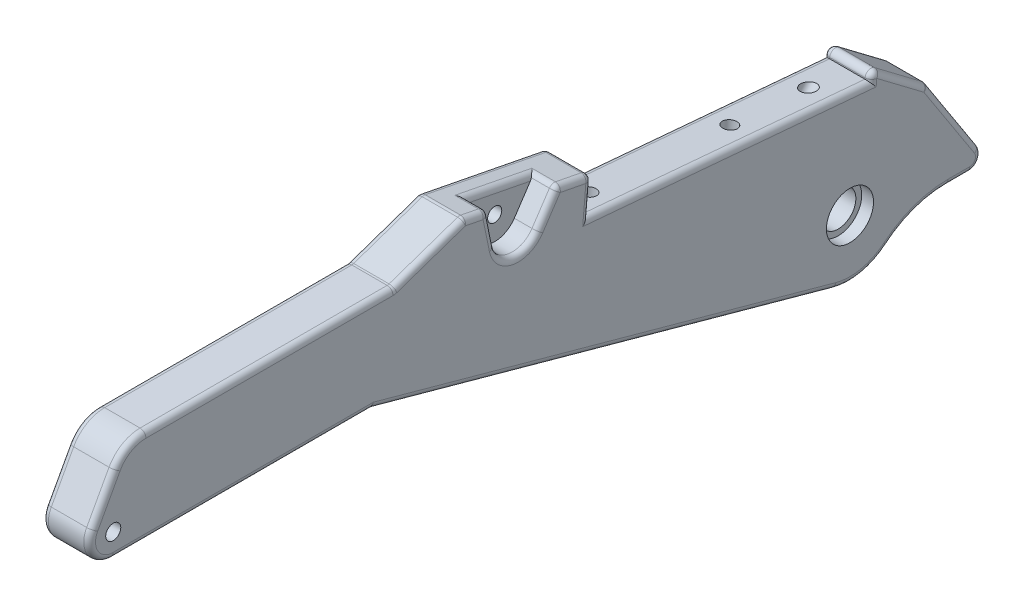
from build123d import *

# Parameters (mm, degrees)
SKETCH1_R           = 2.032
BOSS_EXTRUDE1_DEPTH = 12.7
FILLET1_R           = 9.525
SKETCH2_R           = 4.7625
CUT_EXTRUDE1_DEPTH  = 238.90790865
SKETCH4_R           = 6.35
CUT_EXTRUDE2_DEPTH  = 3.175
CUT_EXTRUDE6_DEPTH  = 6.35
SKETCH10_R          = 1.905
CUT_EXTRUDE7_DEPTH  = 238.653540891
FILLET2_R           = 1.5875
SKETCH6_R           = 1.905
CUT_EXTRUDE3_DEPTH  = 25.4
SKETCH7_R           = 1.905
CUT_EXTRUDE4_DEPTH  = 15.875
SKETCH8_R           = 1.905
CUT_EXTRUDE5_DEPTH  = 12.7


with BuildPart() as part:
    # Sketch1 → Boss-Extrude1 (new body)
    with BuildSketch(Plane(origin=(0, 0, 0), x_dir=(0, 0, -1), z_dir=(1, 0, 0))):
        with BuildLine():
            Line((-5.574599012, 3.040780467), (3.157961292, 19.05))
            Line((3.157961292, 19.05), (75.662744852, 19.05))
            Line((75.662744852, 19.05), (94.776183001, 25.614386431))
            Line((94.776183001, 25.614386431), (129.054233098, 18.923279907))
            Line((129.054233098, 18.923279907), (128.224074649, 9.434525408))
            Line((128.224074649, 9.434525408), (204.134110643, 2.79325781))
            Line((204.134110643, 2.79325781), (204.161005679, 3.100669472))
            ThreePointArc((204.161005679, 3.100669472), (205.09730431, 4.412800765), (206.698779384, 4.229439793))
            Line((206.698779384, 4.229439793), (219.392961654, -5.350975413))
            ThreePointArc((219.392961654, -5.350975413), (219.598467913, -5.536288257), (219.768672831, -5.75447157))
            Line((219.768672831, -5.75447157), (233.444725546, -26.84773219))
            ThreePointArc((233.444725546, -26.84773219), (233.570360338, -30.091006218), (230.780673949, -31.75))
            Line((230.780673949, -31.75), (224.896696771, -31.75))
            ThreePointArc((224.896696771, -31.75), (216.268745771, -33.260285445), (208.666831685, -37.611538462))
            ThreePointArc((208.666831685, -37.611538462), (201.862183679, -40.919877125), (194.299038193, -40.702691568))
            Line((194.299038193, -40.702691568), (69.85, -6.35))
            Line((69.85, -6.35), (0, -6.35))
            ThreePointArc((0, -6.35), (-5.460378007, -3.241415126), (-5.574599012, 3.040780467))
        make_face()
        Circle(SKETCH1_R, mode=Mode.SUBTRACT)
    extrude(amount=BOSS_EXTRUDE1_DEPTH)

    # Fillet1
    fillet1_edges = [part.edges().sort_by_distance(p)[0] for p in [
        (6.35, 19.05, -3.157961292),
    ]]
    fillet(fillet1_edges, radius=FILLET1_R)

    # Sketch2 → Cut-Extrude1 (cut, through all)
    with BuildSketch(Plane.ZY):
        with Locations((-198.523166007, -25.4)):
            Circle(SKETCH2_R)
    extrude(amount=-CUT_EXTRUDE1_DEPTH, mode=Mode.SUBTRACT)

    # Sketch4 → Cut-Extrude2 (cut)
    with BuildSketch(Plane(origin=(12.7, 0, 0), x_dir=(0, 0, -1), z_dir=(1, 0, 0))):
        with Locations((198.523166007, -25.4)):
            Circle(SKETCH4_R)
    extrude(amount=-CUT_EXTRUDE2_DEPTH, mode=Mode.SUBTRACT)

    # Sketch9 → Cut-Extrude6 (cut)
    with BuildSketch(Plane(origin=(12.7, 0, 0), x_dir=(0, 0, -1), z_dir=(1, 0, 0))):
        with BuildLine():
            Line((102.919681037, 15.066518102), (101.008555746, 24.397821608))
            Line((101.008555746, 24.397821608), (119.705673981, 20.748127141))
            Line((119.705673981, 20.748127141), (114.425599951, 12.820552276))
            ThreePointArc((114.425599951, 12.820552276), (107.923985218, 10.108228884), (102.919681037, 15.066518102))
        make_face()
    extrude(amount=-CUT_EXTRUDE6_DEPTH, mode=Mode.SUBTRACT)

    # Sketch10 → Cut-Extrude7 (cut, through all)
    with BuildSketch(Plane(origin=(6.35, 0, 0), x_dir=(0, 0, -1), z_dir=(1, 0, 0))):
        with Locations((109.140550041, 16.340601629)):
            Circle(SKETCH10_R)
    extrude(amount=-CUT_EXTRUDE7_DEPTH, mode=Mode.SUBTRACT)

    # Fillet2
    fillet2_edges = [part.edges().sort_by_distance(p)[0] for p in [
        (0, 2.946963641, -204.147558161),
        (0, 4.412800765, -205.09730431),
        (0, -0.56076781, -213.045870519),
        (0, -5.536288257, -219.598467913),
        (0, -16.30110188, -226.606699189),
        (0, -30.091006218, -233.570360338),
        (0, -31.75, -227.83868536),
        (0, -33.260285445, -216.268745771),
        (0, -40.919877125, -201.862183679),
        (0, -6.35, -34.925),
        (0, -3.241415126, 5.460378007),
        (0, 8.563475584, 2.5621306),
        (0, 17.715567011, -3.950113643),
        (12.7, 2.946963641, -204.147558161),
        (12.7, 4.412800765, -205.09730431),
        (12.7, -0.56076781, -213.045870519),
        (12.7, -5.536288257, -219.598467913),
        (12.7, -16.30110188, -226.606699189),
        (12.7, -30.091006218, -233.570360338),
        (12.7, -31.75, -227.83868536),
        (12.7, -33.260285445, -216.268745771),
        (12.7, -40.919877125, -201.862183679),
        (12.7, -6.35, -34.925),
        (12.7, -3.241415126, 5.460378007),
        (12.7, 8.563475584, 2.5621306),
        (12.7, 17.715567011, -3.950113643),
        (0, -23.526345784, -132.074519097),
        (0, 6.113891609, -166.179092646),
        (0, 14.178902657, -128.639153874),
        (0, 19.05, -42.237490592),
        (12.7, -23.526345784, -132.074519097),
        (12.7, 6.113891609, -166.179092646),
        (12.7, 14.178902657, -128.639153874),
        (12.7, 19.05, -42.237490592),
        (12.7, 19.732169855, -101.964118391),
        (12.7, 16.784339708, -117.065636966),
        (12.7, 10.108228884, -107.923985218),
        (12.7, 19.835703524, -124.37995354),
        (0, 22.268833169, -111.91520805),
        (9.525, 20.748127141, -119.705673981),
        (9.525, 24.397821608, -101.008555746),
        (6.35, 22.572974375, -110.357114863),
        (12.7, 25.006104019, -97.892369373),
        (12.7, 22.332193215, -85.219463927),
        (0, 22.332193215, -85.219463927),
        (6.35, 25.614386431, -94.776183001),
        (6.35, 19.05, -75.662744852),
        (6.35, 18.923279907, -129.054233098),
    ]]
    fillet(fillet2_edges, radius=FILLET2_R)

    # Sketch6 → Cut-Extrude3 (cut)
    with BuildSketch(Plane(origin=(0, 102.082274381, -77.04242407), x_dir=(1, 0, 0), z_dir=(0, 0.798192165141452, -0.6024029112701905))):
        with Locations((6.35, 152.364748226)):
            Circle(SKETCH6_R)
    extrude(amount=-CUT_EXTRUDE3_DEPTH, mode=Mode.SUBTRACT)

    # Sketch7 → Cut-Extrude4 (cut)
    with BuildSketch(Plane(origin=(0, 20.495798036, -1.793149978), x_dir=(1, 0, 0), z_dir=(0, 0.9961946980917459, -0.08715574274765378))):
        with Locations((6.35, 171.363870263)):
            Circle(SKETCH7_R)
        with Locations((6.35, 133.263870263)):
            Circle(SKETCH7_R)
    extrude(amount=-CUT_EXTRUDE4_DEPTH, mode=Mode.SUBTRACT)

    # Sketch8 → Cut-Extrude5 (cut)
    with BuildSketch(Plane(origin=(0, 98.615320401, -152.099344577), x_dir=(-1, 0, 0), z_dir=(0, 0.5440213575001199, -0.839071369183651))):
        with Locations((-6.35, -139.982344987)):
            Circle(SKETCH8_R)
    extrude(amount=-CUT_EXTRUDE5_DEPTH, mode=Mode.SUBTRACT)


solid = part.part
